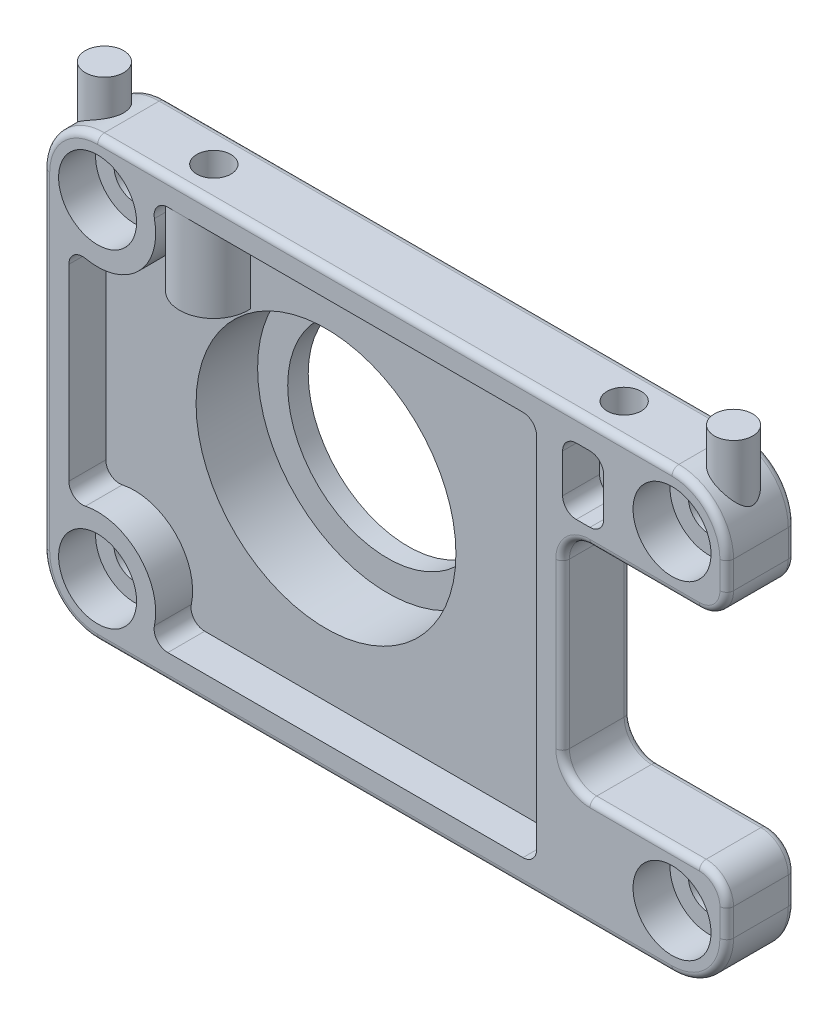
from build123d import *
from build123d.topology import SkipClean

# Parameters (mm, degrees)
SKETCH_1_R             = 1.5
SKETCH_1_R_2           = 9.5
EXTRUDE_1_DEPTH        = 5
SKETCH_2_R             = 2.85
SKETCH_2_W             = 3
SKETCH_2_H             = 4.838747272
CUT_EXTRUDE_1_DEPTH    = 2.7
FILLET_1_R             = 1
FILLET_2_R             = 4
FILLET_3_R             = 2
EXTRUDE_START          = 2.2
SKETCH_3_R             = 11.75
SKETCH_3_R_2           = 9.5
EXTRUDE_2_DEPTH        = 2.2
EXTRUDE_START_2        = 1.5
SKETCH_4_R             = 11.75
SKETCH_4_R_2           = 7.3
EXTRUDE_3_DEPTH        = 1.5
FILLET_4_R             = 0.5
FILLET_5_R             = 0.5
EXTRUDE_7_DEPTH        = 8
HOLE_WIZARD_M3_3_D     = 2.5
HOLE_WIZARD_M3_3_DEPTH = 5.5
HOLE_WIZARD_M3_3_TIP   = 0.751075774
FILLET_6_R             = 0.5
EXTRUDE_8_REACH        = 62.953
EXTRUDE_8_END_RADIUS   = 4
SKETCH_14_R            = 1.4


with BuildPart() as part:
    # 草图1 → 凸台-拉伸1 (new body)
    with BuildSketch(Plane.XY):
        Polygon((0, 0), (50, 0), (50, 8), (38, 8), (38, 24), (50, 24), (50, 32), (0, 32), align=None)
        with Locations((4, 28)):
            Circle(SKETCH_1_R, mode=Mode.SUBTRACT)
        with Locations((46, 28)):
            Circle(SKETCH_1_R, mode=Mode.SUBTRACT)
        with Locations((46, 4)):
            Circle(SKETCH_1_R, mode=Mode.SUBTRACT)
        with Locations((4, 4)):
            Circle(SKETCH_1_R, mode=Mode.SUBTRACT)
        with Locations((18, 16)):
            Circle(SKETCH_1_R_2, mode=Mode.SUBTRACT)
    extrude(amount=EXTRUDE_1_DEPTH)

    # 草图2 → 切除-拉伸1 (cut)
    with BuildSketch(Plane.XY.offset(5)):
        with Locations((4, 28)):
            Circle(SKETCH_2_R)
        with Locations((4, 4)):
            Circle(SKETCH_2_R)
        with Locations((46, 4)):
            Circle(SKETCH_2_R)
        with Locations((46, 28)):
            Circle(SKETCH_2_R)
        with Locations((39.5, 27.680626364)):
            Rectangle(SKETCH_2_W, SKETCH_2_H)
        with BuildLine():
            Line((36.1, 1.9), (36.1, 30.1))
            Line((36.1, 30.1), (7.694928957, 30.1))
            ThreePointArc((7.694928957, 30.1), (7.00520382, 24.99479618), (1.9, 24.305071043))
            Line((1.9, 24.305071043), (1.9, 7.694928957))
            ThreePointArc((1.9, 7.694928957), (7.00520382, 7.00520382), (7.694928957, 1.9))
            Line((7.694928957, 1.9), (36.1, 1.9))
        make_face()
    extrude(amount=-CUT_EXTRUDE_1_DEPTH, mode=Mode.SUBTRACT)

    # 圆角1
    fillet_1_edges = [part.edges().sort_by_distance(p)[0] for p in [
        (38, 25.261252728, 3.65),
        (38, 30.1, 3.65),
        (41, 30.1, 3.65),
        (41, 25.261252728, 3.65),
        (7.694928957, 1.9, 3.65),
        (1.9, 7.694928957, 3.65),
        (1.9, 24.305071043, 3.65),
        (7.694928957, 30.1, 3.65),
        (36.1, 30.1, 3.65),
        (36.1, 1.9, 3.65),
    ]]
    fillet(fillet_1_edges, radius=FILLET_1_R)

    # 圆角2
    fillet_2_edges = [part.edges().sort_by_distance(p)[0] for p in [
        (0, 32, 2.5),
        (50, 32, 2.5),
        (50, 0, 2.5),
        (0, 0, 2.5),
    ]]
    fillet(fillet_2_edges, radius=FILLET_2_R)

    # 圆角3
    fillet_3_edges = [part.edges().sort_by_distance(p)[0] for p in [
        (50, 24, 2.5),
        (38, 24, 2.5),
        (38, 8, 2.5),
        (50, 8, 2.5),
    ]]
    fillet(fillet_3_edges, radius=FILLET_3_R)

    # 草图3 → 凸台-拉伸2 (add)
    with SkipClean():  # the faces are left unmerged after this step: merging them gives an invalid solid
        with BuildSketch(Plane(origin=(0, 0, 0), x_dir=(-1, 0, 0), z_dir=(0, 0, -1)).offset(EXTRUDE_START)):
            with Locations((-18, 16)):
                Circle(SKETCH_3_R)
            with Locations((-18, 16)):
                Circle(SKETCH_3_R_2, mode=Mode.SUBTRACT)
        extrude(amount=-EXTRUDE_2_DEPTH)

    # 草图4 → 凸台-拉伸3 (add)
    with SkipClean():  # the faces are left unmerged after this step: merging them gives an invalid solid
        with BuildSketch(Plane(origin=(0, 0, -2.2), x_dir=(-1, 0, 0), z_dir=(0, 0, -1)).offset(EXTRUDE_START_2)):
            with Locations((-18, 16)):
                Circle(SKETCH_4_R)
            with Locations((-18, 16)):
                Circle(SKETCH_4_R_2, mode=Mode.SUBTRACT)
        extrude(amount=-EXTRUDE_3_DEPTH)

    # 圆角4
    fillet_4_edges = [part.edges().sort_by_distance(p)[0] for p in [
        (29.75, 16, -3.7),
    ]]
    fillet(fillet_4_edges, radius=FILLET_4_R)

    # 圆角5
    fillet_5_edges = [part.edges().sort_by_distance(p)[0] for p in [
        (25, 0, 0),
        (0, 16, 0),
        (25, 32, 0),
        (50, 5, 0),
        (48.828427125, 30.828427125, 0),
        (48.828427125, 1.171572875, 0),
        (1.171572875, 30.828427125, 0),
        (1.171572875, 1.171572875, 0),
        (44, 24, 0),
        (38, 16, 0),
        (44, 8, 0),
        (50, 27, 0),
        (49.414213562, 24.585786438, 0),
        (49.414213562, 7.414213562, 0),
        (38.585786438, 23.414213562, 0),
        (38.585786438, 8.585786438, 0),
    ]]
    fillet(fillet_5_edges, radius=FILLET_5_R)

    # 草图11 → 凸台-拉伸7 (add)
    with BuildSketch(Plane(origin=(0, 32, 0), x_dir=(1, 0, 0), z_dir=(0, 1, 0))):
        with BuildLine():
            Line((12.491987159, -2.3), (7.508012841, -2.3))
            ThreePointArc((7.508012841, -2.3), (10, -5), (12.491987159, -2.3))
        make_face()
    extrude(amount=-EXTRUDE_7_DEPTH)

    # M3 螺纹孔3
    with Locations(Plane(origin=(0, 32, 0), x_dir=(1, 0, 0), z_dir=(0, 1, 0))):
        with Locations((10, -2.5), (40, -2.5)):
            Hole(HOLE_WIZARD_M3_3_D / 2, depth=HOLE_WIZARD_M3_3_DEPTH)
            with Locations((0, 0, -(HOLE_WIZARD_M3_3_DEPTH + HOLE_WIZARD_M3_3_TIP / 2))):  # 118° drill point
                Cone(0, HOLE_WIZARD_M3_3_D / 2, HOLE_WIZARD_M3_3_TIP, mode=Mode.SUBTRACT)

    # 圆角6
    # the kernel refuses this fillet: 0.5 mm, written as the material it takes off along each edge
    with BuildSketch(Plane(origin=(4, 0, 5), x_dir=(0, 1, 0), z_dir=(1, 0, 0))) as fillet_6_piece_1:
        with BuildLine():
            CenterArc((FILLET_6_R, -FILLET_6_R), FILLET_6_R, 90, 90)
            Line((0, -FILLET_6_R), (0, 0))
            Line((0, 0), (FILLET_6_R, 0))
        make_face()
    extrude(amount=42, mode=Mode.SUBTRACT)
    with BuildSketch(Plane(origin=(0, 28, 5), x_dir=(1, 0, 0), z_dir=(0, -1, 0))) as fillet_6_piece_2:
        with BuildLine():
            CenterArc((FILLET_6_R, -FILLET_6_R), FILLET_6_R, 90, 90)
            Line((0, -FILLET_6_R), (0, 0))
            Line((0, 0), (FILLET_6_R, 0))
        make_face()
    extrude(amount=24, mode=Mode.SUBTRACT)
    with BuildSketch(Plane(origin=(50, 4, 5), x_dir=(-1, 0, 0), z_dir=(0, 1, 0)), Plane(origin=(50, 26, 5), x_dir=(-1, 0, 0), z_dir=(0, 1, 0))) as fillet_6_piece_3:
        with BuildLine():
            CenterArc((FILLET_6_R, -FILLET_6_R), FILLET_6_R, 90, 90)
            Line((0, -FILLET_6_R), (0, 0))
            Line((0, 0), (FILLET_6_R, 0))
        make_face()
    extrude(amount=2, mode=Mode.SUBTRACT)
    with BuildSketch(Plane(origin=(46, 32, 5), x_dir=(0, -1, 0), z_dir=(-1, 0, 0))) as fillet_6_piece_4:
        with BuildLine():
            CenterArc((FILLET_6_R, -FILLET_6_R), FILLET_6_R, 90, 90)
            Line((0, -FILLET_6_R), (0, 0))
            Line((0, 0), (FILLET_6_R, 0))
        make_face()
    extrude(amount=36.000000034, mode=Mode.SUBTRACT)
    with BuildSketch(Plane(origin=(46, 28, 5), x_dir=(0, 1, 0), z_dir=(-1, 0, 0))) as fillet_6_piece_5:
        with BuildLine():
            CenterArc((4 - FILLET_6_R, FILLET_6_R), FILLET_6_R, 270, 90)
            Line((4, FILLET_6_R), (4, 0))
            Line((4, 0), (4 - FILLET_6_R, 0))
        make_face()
    revolve(axis=Axis((46, 28, 5), (0, 0, -1)), revolution_arc=90, mode=Mode.SUBTRACT)
    with BuildSketch(Plane(origin=(46, 4, 5), x_dir=(0, -1, 0), z_dir=(-1, 0, 0))) as fillet_6_piece_6:
        with BuildLine():
            CenterArc((4 - FILLET_6_R, -FILLET_6_R), FILLET_6_R, 0, 90)
            Line((4, -FILLET_6_R), (4, 0))
            Line((4, 0), (4 - FILLET_6_R, 0))
        make_face()
    revolve(axis=Axis((46, 4, 5), (0, 0, 1)), revolution_arc=90, mode=Mode.SUBTRACT)
    with BuildSketch(Plane(origin=(4, 28, 5), x_dir=(-1, 0, 0), z_dir=(0, -1, 0))) as fillet_6_piece_7:
        with BuildLine():
            CenterArc((4 - FILLET_6_R, FILLET_6_R), FILLET_6_R, 270, 90)
            Line((4, FILLET_6_R), (4, 0))
            Line((4, 0), (4 - FILLET_6_R, 0))
        make_face()
    revolve(axis=Axis((4, 28, 5), (0, 0, -1)), revolution_arc=90, mode=Mode.SUBTRACT)
    with BuildSketch(Plane(origin=(4, 4, 5), x_dir=(0, -1, 0), z_dir=(1, 0, 0))) as fillet_6_piece_8:
        with BuildLine():
            CenterArc((4 - FILLET_6_R, FILLET_6_R), FILLET_6_R, 270, 90)
            Line((4, FILLET_6_R), (4, 0))
            Line((4, 0), (4 - FILLET_6_R, 0))
        make_face()
    revolve(axis=Axis((4, 4, 5), (0, 0, -1)), revolution_arc=90, mode=Mode.SUBTRACT)
    with BuildSketch(Plane(origin=(40, 24, 5), x_dir=(0, 1, 0), z_dir=(1, 0, 0)), Plane(origin=(48, 8, 5), x_dir=(0, -1, 0), z_dir=(-1, 0, 0))) as fillet_6_piece_9:
        with BuildLine():
            CenterArc((FILLET_6_R, -FILLET_6_R), FILLET_6_R, 90, 90)
            Line((0, -FILLET_6_R), (0, 0))
            Line((0, 0), (FILLET_6_R, 0))
        make_face()
    extrude(amount=8, mode=Mode.SUBTRACT)
    with BuildSketch(Plane(origin=(38, 10, 5), x_dir=(-1, 0, 0), z_dir=(0, 1, 0))) as fillet_6_piece_10:
        with BuildLine():
            CenterArc((FILLET_6_R, -FILLET_6_R), FILLET_6_R, 90, 90)
            Line((0, -FILLET_6_R), (0, 0))
            Line((0, 0), (FILLET_6_R, 0))
        make_face()
    extrude(amount=12, mode=Mode.SUBTRACT)
    with BuildSketch(Plane(origin=(48, 26, 5), x_dir=(0, -1, 0), z_dir=(-1, 0, 0))) as fillet_6_piece_11:
        with BuildLine():
            CenterArc((2 - FILLET_6_R, -FILLET_6_R), FILLET_6_R, 0, 90)
            Line((2, -FILLET_6_R), (2, 0))
            Line((2, 0), (2 - FILLET_6_R, 0))
        make_face()
    revolve(axis=Axis((48, 26, 5), (0, 0, 1)), revolution_arc=90, mode=Mode.SUBTRACT)
    with BuildSketch(Plane(origin=(48, 6, 5), x_dir=(1, 0, 0), z_dir=(0, -1, 0))) as fillet_6_piece_12:
        with BuildLine():
            CenterArc((2 - FILLET_6_R, -FILLET_6_R), FILLET_6_R, 0, 90)
            Line((2, -FILLET_6_R), (2, 0))
            Line((2, 0), (2 - FILLET_6_R, 0))
        make_face()
    revolve(axis=Axis((48, 6, 5), (0, 0, 1)), revolution_arc=90, mode=Mode.SUBTRACT)
    with BuildSketch(Plane(origin=(40, 22, 5), x_dir=(-1, 0, 0), z_dir=(0, -1, 0))) as fillet_6_piece_13:
        with BuildLine():
            CenterArc((2 + FILLET_6_R, FILLET_6_R), FILLET_6_R, 180, 90)
            Line((2, FILLET_6_R), (2, 0))
            Line((2, 0), (2 + FILLET_6_R, 0))
        make_face()
    revolve(axis=Axis((40, 22, 5), (0, 0, -1)), revolution_arc=90, mode=Mode.SUBTRACT)
    with BuildSketch(Plane(origin=(40, 10, 5), x_dir=(0, -1, 0), z_dir=(1, 0, 0))) as fillet_6_piece_14:
        with BuildLine():
            CenterArc((2 + FILLET_6_R, FILLET_6_R), FILLET_6_R, 180, 90)
            Line((2, FILLET_6_R), (2, 0))
            Line((2, 0), (2 + FILLET_6_R, 0))
        make_face()
    revolve(axis=Axis((40, 10, 5), (0, 0, -1)), revolution_arc=90, mode=Mode.SUBTRACT)
    with BuildSketch(Plane(origin=(9.999999966, 32, 5), x_dir=(0, -1, 0), z_dir=(-1, 0, 0))) as fillet_6_piece_15:
        with BuildLine():
            CenterArc((FILLET_6_R, -FILLET_6_R), FILLET_6_R, 90, 90)
            Line((0, -FILLET_6_R), (0, 0))
            Line((0, 0), (FILLET_6_R, 0))
        make_face()
    extrude(amount=5.999999966, mode=Mode.SUBTRACT)

    # 凸台-拉伸8: up to this cylinder (the profile starts outside it)
    extrude_8_end = Plane(origin=(4, 28, 2.5), z_dir=(0, 0, -1)) * Cylinder(EXTRUDE_8_END_RADIUS, 134.906, mode=Mode.PRIVATE)
    # 草图14 → 凸台-拉伸8 (add, up to the surface)
    with BuildSketch(Plane(origin=(0, 34.5, 0), x_dir=(1, 0, 0), z_dir=(0, 1, 0)), mode=Mode.PRIVATE) as extrude_8_sk1:
        with Locations(Location((2, -2.5, 0), (0, 0, 270))):
            Circle(SKETCH_14_R)
    extrude_8_tool1 = extrude(extrude_8_sk1.sketch, amount=-EXTRUDE_8_REACH, mode=Mode.PRIVATE) - extrude_8_end
    extrude_8 = extrude_8_tool1.solids().sort_by_distance((2, 34.5, 2.5))[0]
    add(extrude_8)

    # 镜向7: 凸台-拉伸8 across plane
    add(extrude_8.mirror(Plane(origin=(25, 0, 0), x_dir=(0, 0, 1), z_dir=(1, 0, 0))))


solid = part.part
